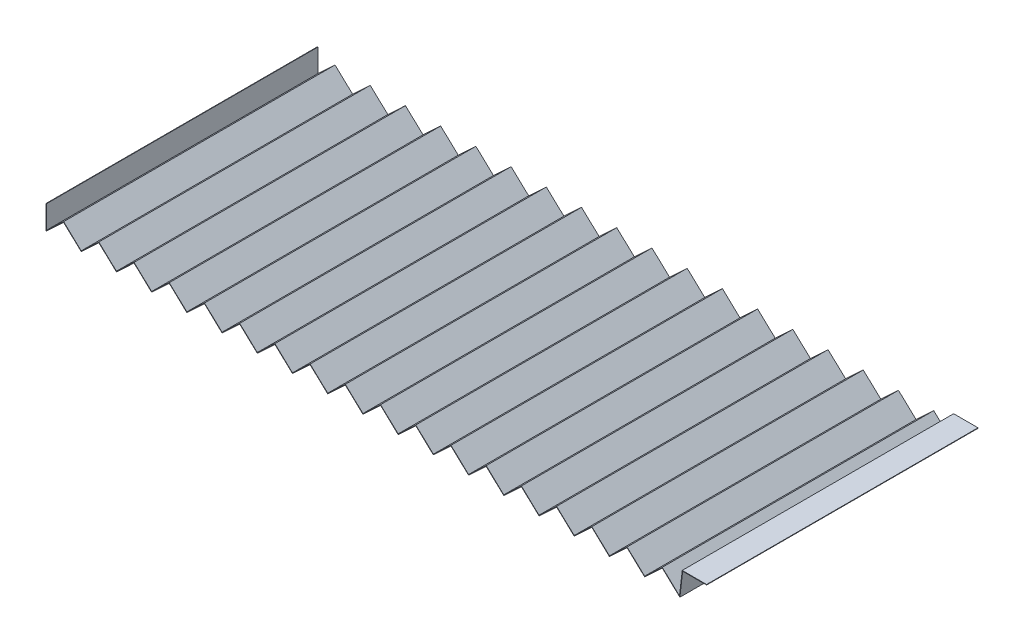
from build123d import *

# Parameters (mm, degrees)
EXTRUDE_THIN1_DEPTH = 85


with BuildPart() as part:
    # Sketch1 → Extrude-Thin1 (new, symmetric)
    with BuildSketch(Plane.XY):
        Polygon((0, 15.1), (0, 0), (11.028974641, 10.313666582), (22.057949281, 0), (33.086923922, 10.313666582), (44.115898563, 0), (55.144873204, 10.313666582), (66.173847844, 0), (77.202822485, 10.313666582), (88.231797126, 0), (99.260771767, 10.313666582), (110.289746407, 0), (121.318721048, 10.313666582), (132.347695689, 0), (143.37667033, 10.313666582), (154.40564497, 0), (165.434619611, 10.313666582), (176.463594252, 0), (187.492568893, 10.313666582), (198.521543533, 0), (209.550518174, 10.313666582), (220.579492815, 0), (231.608467455, 10.313666582), (242.637442096, 0), (253.666416737, 10.313666582), (264.695391378, 0), (275.724366018, 10.313666582), (286.753340659, 0), (297.7823153, 10.313666582), (308.811289941, 0), (319.840264581, 10.313666582), (330.869239222, 0), (341.898213863, 10.313666582), (352.927188504, 0), (363.956163144, 10.313666582), (374.985137785, 0), (386.014112426, 10.313666582), (397.043087067, 0), (398.778022224, 15), (413.778022224, 15), (413.778022224, 15.3), (398.510720927, 15.3), (396.813433323, 0.625495331), (386.014112426, 10.724402861), (374.985137785, 0.410736279), (363.956163144, 10.724402861), (352.927188504, 0.410736279), (341.898213863, 10.724402861), (330.869239222, 0.410736279), (319.840264581, 10.724402861), (308.811289941, 0.410736279), (297.7823153, 10.724402861), (286.753340659, 0.410736279), (275.724366018, 10.724402861), (264.695391378, 0.410736279), (253.666416737, 10.724402861), (242.637442096, 0.410736279), (231.608467455, 10.724402861), (220.579492815, 0.410736279), (209.550518174, 10.724402861), (198.521543533, 0.410736279), (187.492568893, 10.724402861), (176.463594252, 0.410736279), (165.434619611, 10.724402861), (154.40564497, 0.410736279), (143.37667033, 10.724402861), (132.347695689, 0.410736279), (121.318721048, 10.724402861), (110.289746407, 0.410736279), (99.260771767, 10.724402861), (88.231797126, 0.410736279), (77.202822485, 10.724402861), (66.173847844, 0.410736279), (55.144873204, 10.724402861), (44.115898563, 0.410736279), (33.086923922, 10.724402861), (22.057949281, 0.410736279), (11.028974641, 10.724402861), (0.3, 0.691279128), (0.3, 15.1), align=None)
    extrude(amount=EXTRUDE_THIN1_DEPTH, both=True)


solid = part.part
